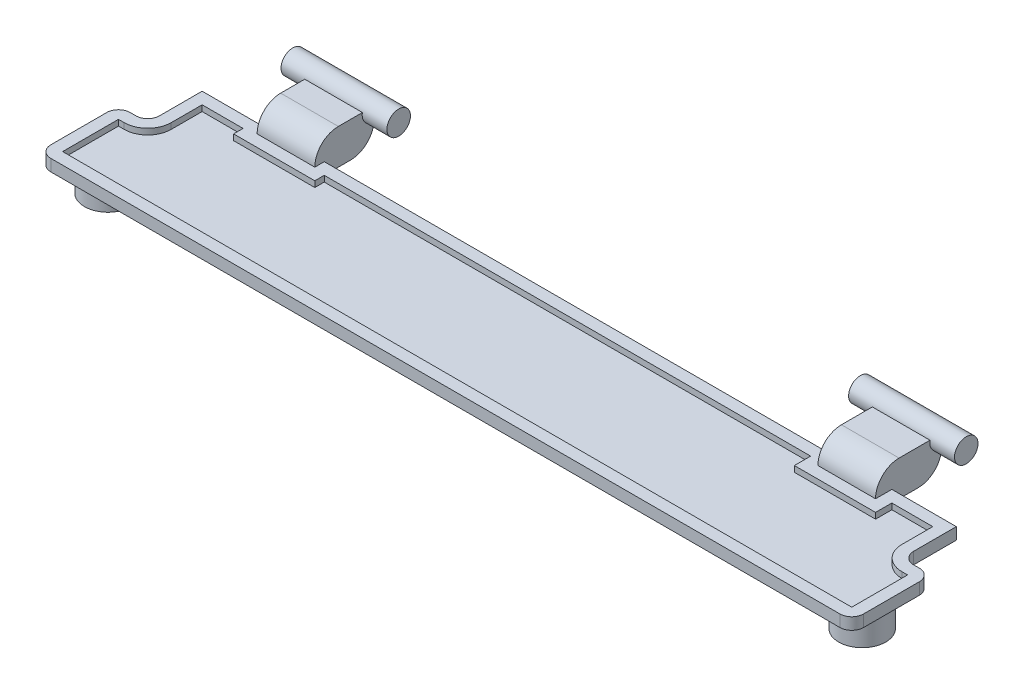
from build123d import *

# Parameters (mm, degrees)
SKETCH1_R                = 2
BOSS_EXTRUDE1_DEPTH      = 2.5
BOSS_EXTRUDE1_2_DEPTH    = 2.5
BOSS_EXTRUDE3_DEPTH      = 1
FILLET1_R                = 1
BOSS_EXTRUDE4_DEPTH      = 2
BOSS_EXTRUDE4_DEPTH_BACK = 1
SKETCH3_W                = 4.9
SKETCH3_H                = 5.030022666
SKETCH3_H_2              = 5.609354891
BOSS_EXTRUDE5_DEPTH      = 2
BOSS_EXTRUDE5_DEPTH_BACK = 7
SKETCH4_R                = 1
BOSS_EXTRUDE6_DEPTH      = 2
BOSS_EXTRUDE6_DEPTH_BACK = 7
SKETCH5_R                = 1
FILLET2_R                = 2
FILLET3_R                = 2
CUT_EXTRUDE1_DEPTH       = 0.5
FILLET4_R                = 2


# Some blends are built 0.0001 mm under size
with BuildPart() as part:
    # Sketch1 → Boss-Extrude1 (new body)
    with BuildSketch(Plane(origin=(0, 0, 0), x_dir=(1, 0, 0), z_dir=(0, 1, 0))):
        with Locations(Location((64.1, 0, 0), (0, 0, 270))):
            Circle(SKETCH1_R)
    extrude(amount=BOSS_EXTRUDE1_DEPTH)



with BuildPart() as body_2:
    # Sketch1 → Boss-Extrude1 2 (new body)
    with BuildSketch(Plane(origin=(0, 0, 0), x_dir=(1, 0, 0), z_dir=(0, 1, 0))):
        with Locations(Location((0, 0, 0), (0, 0, 270))):
            Circle(SKETCH1_R)
    extrude(amount=BOSS_EXTRUDE1_2_DEPTH)


with BuildPart() as part_1:
    add(part.part)

    add(body_2.part)  # Boss-Extrude3 merges body 2
    # Sketch2 → Boss-Extrude3 (add)
    with BuildSketch(Plane(origin=(0, 2.5, 0), x_dir=(1, 0, 0), z_dir=(0, 1, 0))):
        Polygon((0, 3.373067478), (0, 8), (64.1, 8), (64.1, 3.373067478), (66.585371827, 3.373067478), (66.585371827, -3.373067478), (-2.485371827, -3.373067478), (-2.485371827, 3.373067478), align=None)
    extrude(amount=BOSS_EXTRUDE3_DEPTH)

    # Fillet1
    fillet1_edges = [part_1.edges().sort_by_distance(p)[0] for p in [
        (64.1, 3, -3.373067478),
        (0, 3, -3.373067478),
        (-2.485371827, 3, -3.373067478),
        (-2.485371827, 3, 3.373067478),
        (66.585371827, 3, 3.373067478),
        (66.585371827, 3, -3.373067478),
    ]]
    fillet(fillet1_edges, radius=FILLET1_R)

    # Sketch3 → Boss-Extrude4 (add, two sides: drawn at the far end of the back side and taken through both)
    with BuildSketch(Plane(origin=(0, 3.5, 0), x_dir=(1, 0, 0), z_dir=(0, 1, 0)).offset(-BOSS_EXTRUDE4_DEPTH_BACK)):
        with Locations((7.93, 9.710321272)):
            Rectangle(SKETCH3_W, SKETCH3_H)
        with Locations((56.17, 9.42065516)):
            Rectangle(SKETCH3_W, SKETCH3_H_2)
    extrude(amount=BOSS_EXTRUDE4_DEPTH + BOSS_EXTRUDE4_DEPTH_BACK)

    # Sketch4 → Boss-Extrude5 (add, two sides: drawn at the far end of the back side and taken through both)
    with BuildSketch(Plane.ZY.offset(-5.48).offset(-BOSS_EXTRUDE5_DEPTH_BACK)):
        with Locations((-12.225332605, 5.316497078)):
            Circle(SKETCH4_R)
    extrude(amount=BOSS_EXTRUDE5_DEPTH + BOSS_EXTRUDE5_DEPTH_BACK)

    # Sketch5 → Boss-Extrude6 (add, two sides: drawn at the far end of the back side and taken through both)
    with BuildSketch(Plane.ZY.offset(-53.72).offset(-BOSS_EXTRUDE6_DEPTH_BACK)):
        with Locations((-12.225332605, 5.316497078)):
            Circle(SKETCH5_R)
    extrude(amount=BOSS_EXTRUDE6_DEPTH + BOSS_EXTRUDE6_DEPTH_BACK)

    # Fillet2
    fillet2_edges = [part_1.edges().sort_by_distance(p)[0] for p in [
        (56.17, 5.5, -6.615977714),
        (7.93, 5.5, -7.195309939),
    ]]
    fillet(fillet2_edges, radius=FILLET2_R - 0.0001)  # a hair under: the kernel refuses the full size

    # Fillet3
    # the kernel refuses this fillet: 2 mm, written as the material it takes off along each edge
    with BuildSketch(Plane(origin=(48.741090307, 2.5, -12.225332605), x_dir=(0, 0, 1), z_dir=(1, 0, 0))) as fillet3_piece_1:
        with BuildLine():
            CenterArc((1.991563877, -2), FILLET3_R, 90, 84.735624625)
            Line((0, -1.816497078), (-0.039831278, -1.81282702))
            ThreePointArc((-0.039831278, -1.81282702), (-0.04, -0.908248539), (-0.04, 0))
            Line((-0.04, 0), (0, 0.04))
            Line((0, 0.04), (1.991563877, 0.04))
            Line((1.991563877, 0.04), (1.991563877, 0))
        make_face()
    extrude(amount=14.857819387, mode=Mode.SUBTRACT)

    # Sketch6 → Cut-Extrude1 (cut)
    with BuildSketch(Plane(origin=(0, 3.5, 0), x_dir=(1, 0, 0), z_dir=(0, 1, 0))):
        with BuildLine():
            Line((59.62, 5.615977714), (52.72, 5.615977714))
            Line((52.72, 5.615977714), (52.72, 7))
            Line((52.72, 7), (11.38, 7))
            Line((11.38, 7), (11.38, 6.195309939))
            Line((11.38, 6.195309939), (4.48, 6.195309939))
            Line((4.48, 6.195309939), (4.48, 7))
            Line((4.48, 7), (1, 7))
            Line((1, 7), (1, 4.373067478))
            ThreePointArc((1, 4.373067478), (0.414213562, 2.958853916), (-1, 2.373067478))
            Line((-1, 2.373067478), (-1.485371827, 2.373067478))
            Line((-1.485371827, 2.373067478), (-1.485371827, -2.373067478))
            Line((-1.485371827, -2.373067478), (65.585371827, -2.373067478))
            Line((65.585371827, -2.373067478), (65.585371827, 2.373067478))
            Line((65.585371827, 2.373067478), (65.1, 2.373067478))
            ThreePointArc((65.1, 2.373067478), (63.685786438, 2.958853916), (63.1, 4.373067478))
            Line((63.1, 4.373067478), (63.1, 7))
            Line((63.1, 7), (59.62, 7))
            Line((59.62, 7), (59.62, 5.615977714))
        make_face()
    extrude(amount=-CUT_EXTRUDE1_DEPTH, mode=Mode.SUBTRACT)

    # Fillet4
    # the kernel refuses this fillet: 2 mm, written as the material it takes off along each edge
    with BuildSketch(Plane(origin=(15.358909693, 2.5, -12.225332605), x_dir=(0, 0, 1), z_dir=(-1, 0, 0))) as fillet4_piece_1:
        with BuildLine():
            CenterArc((1.991563877, 2), FILLET4_R, 185.264375375, 84.735624625)
            Line((0, 1.816497078), (-0.039831278, 1.81282702))
            ThreePointArc((-0.039831278, 1.81282702), (-0.04, 0.908248539), (-0.04, 0))
            Line((-0.04, 0), (0, -0.04))
            Line((0, -0.04), (1.991563877, -0.04))
            Line((1.991563877, -0.04), (1.991563877, 0))
        make_face()
    extrude(amount=14.857819387, mode=Mode.SUBTRACT)


solid = part_1.part
